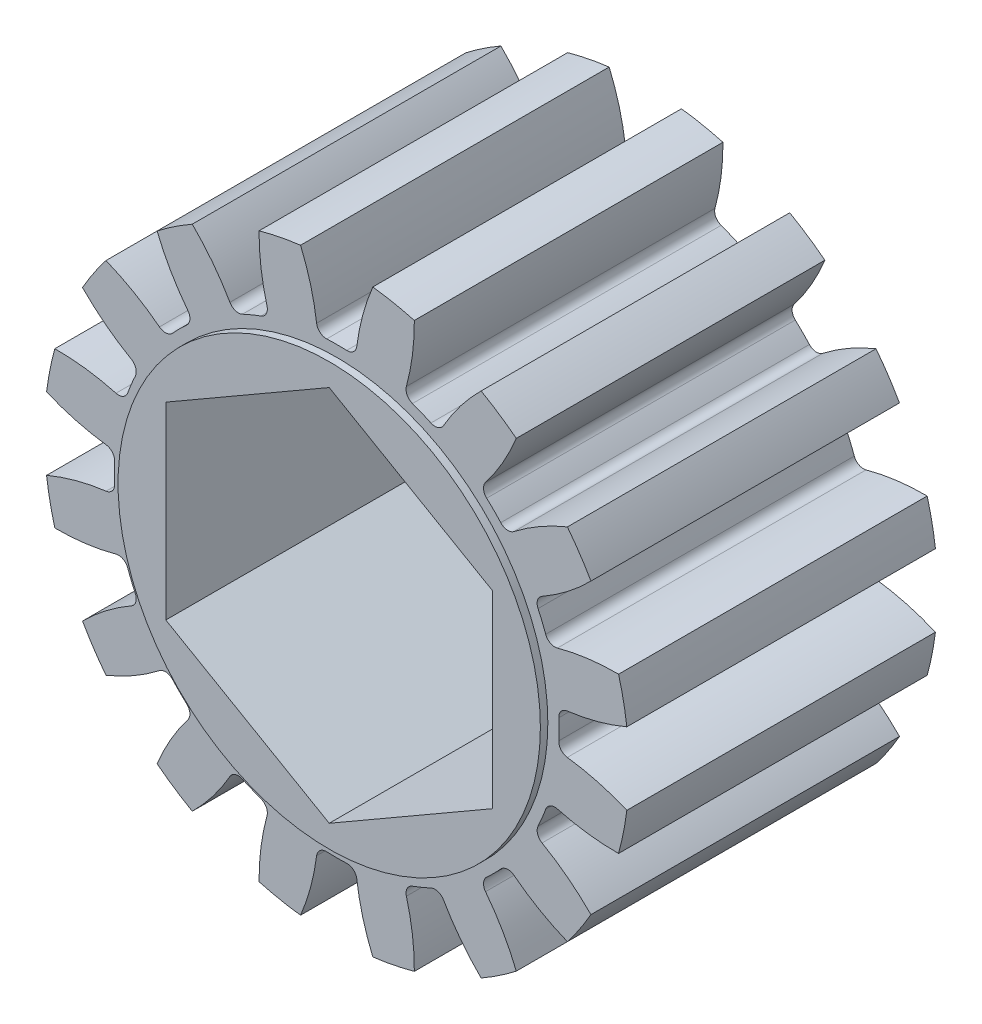
from build123d import *

# Parameters (mm, degrees)
CROQUIS1_R                 = 11.43
SALIENTE_EXTRUIR1_DEPTH    = 6.0325
CORTAR_EXTRUIR1_DEPTH      = 18.253430275
REDONDEO1_R                = 0.381028065
MATRIZC1_COUNT             = 16
REDONDEO1_OF_MATRIZC1_R    = 0.381028065
CROQUIS3_R                 = 8.255
SALIENTE_EXTRUIR2_DEPTH    = 6.3246
CORTAR_EXTRUIR2_DEPTH      = 18.242299714
CORTAR_EXTRUIR2_DEPTH_BACK = 18.242299714


with BuildPart() as part:
    # Croquis1 → Saliente-Extruir1 (new, symmetric)
    with BuildSketch(Plane.XY):
        Circle(CROQUIS1_R)
    extrude(amount=SALIENTE_EXTRUIR1_DEPTH, both=True)

    # Croquis2 → Cortar-Extruir1 (cut, symmetric)
    with BuildSketch(Plane.XY):
        with BuildLine():
            ThreePointArc((0.747134277, 8.658434763), (0, 8.69061), (-0.747134277, 8.658434763))
            ThreePointArc((-0.747134277, 8.658434763), (-0.974448264, 10.026589531), (-1.413058789, 11.342317438))
            ThreePointArc((-1.413058789, 11.342317438), (0, 11.43), (1.413058789, 11.342317438))
            ThreePointArc((1.413058789, 11.342317438), (0.974448264, 10.026589531), (0.747134277, 8.658434763))
        make_face()
    cortar_extruir1 = extrude(amount=CORTAR_EXTRUIR1_DEPTH, both=True, mode=Mode.SUBTRACT)

    # Redondeo1
    redondeo1_edges = [part.edges().sort_by_distance(p)[0] for p in [
        (0.747134277, 8.658434763, 0),
        (-0.747134277, 8.658434763, 0),
    ]]
    fillet(redondeo1_edges, radius=REDONDEO1_R)

    # MatrizC1: Cortar-Extruir1 ×16 about axis
    matrizc1_axis = Axis((0, 0, 6.0325), (0, 0, -1))
    for i in range(1, MATRIZC1_COUNT):
        add(cortar_extruir1.rotate(matrizc1_axis, i * 360 / MATRIZC1_COUNT), mode=Mode.SUBTRACT)

    # Redondeo1 of MatrizC1
    redondeo1_of_matrizc1_edges = [part.edges().sort_by_distance(p)[0] for p in [
        (4.003701601, 7.713434751, 0),
        (2.623177467, 8.285266571, 0),
        (6.650741649, 5.594134221, 0),
        (5.594134221, 6.650741649, 0),
        (8.285266571, 2.623177467, 0),
        (7.713434751, 4.003701601, 0),
        (8.658434763, -0.747134277, 0),
        (8.658434763, 0.747134277, 0),
        (7.713434751, -4.003701601, 0),
        (8.285266571, -2.623177467, 0),
        (5.594134221, -6.650741649, 0),
        (6.650741649, -5.594134221, 0),
        (2.623177467, -8.285266571, 0),
        (4.003701601, -7.713434751, 0),
        (-0.747134277, -8.658434763, 0),
        (0.747134277, -8.658434763, 0),
        (-4.003701601, -7.713434751, 0),
        (-2.623177467, -8.285266571, 0),
        (-6.650741649, -5.594134221, 0),
        (-5.594134221, -6.650741649, 0),
        (-8.285266571, -2.623177467, 0),
        (-7.713434751, -4.003701601, 0),
        (-8.658434763, 0.747134277, 0),
        (-8.658434763, -0.747134277, 0),
        (-7.713434751, 4.003701601, 0),
        (-8.285266571, 2.623177467, 0),
        (-5.594134221, 6.650741649, 0),
        (-6.650741649, 5.594134221, 0),
        (-2.623177467, 8.285266571, 0),
        (-4.003701601, 7.713434751, 0),
    ]]
    fillet(redondeo1_of_matrizc1_edges, radius=REDONDEO1_OF_MATRIZC1_R)

    # Croquis3 → Saliente-Extruir2 (add, symmetric)
    with BuildSketch(Plane.XY):
        Circle(CROQUIS3_R)
    extrude(amount=SALIENTE_EXTRUIR2_DEPTH, both=True)

    # Croquis4 → Cortar-Extruir2 (cut, two sides: drawn at the far end of the back side and taken through both)
    with BuildSketch(Plane.XY.offset(-CORTAR_EXTRUIR2_DEPTH_BACK)):
        Polygon((0, 7.376342509), (-6.3881, 3.688171255), (-6.3881, -3.688171255), (0, -7.376342509), (6.3881, -3.688171255), (6.3881, 3.688171255), align=None)
    extrude(amount=CORTAR_EXTRUIR2_DEPTH + CORTAR_EXTRUIR2_DEPTH_BACK, mode=Mode.SUBTRACT)


solid = part.part
